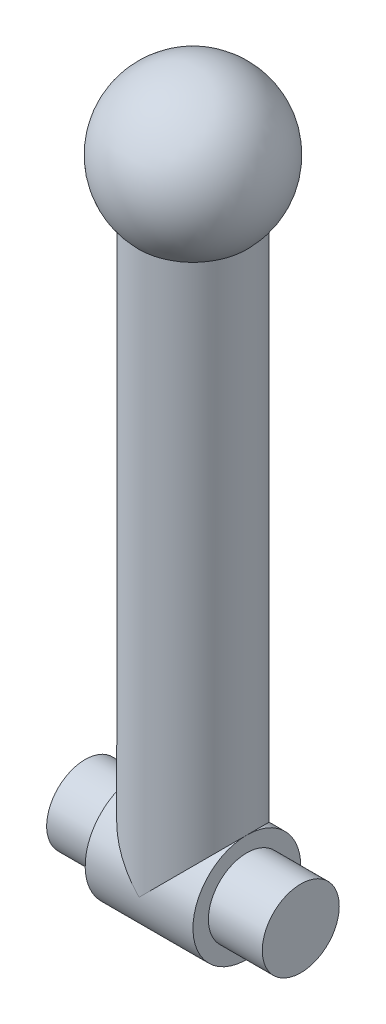
from build123d import *
from build123d.topology import SkipClean

# Parameters (mm, degrees)
SKETCH1_R                = 35
BOSS_EXTRUDE1_DEPTH      = 400
BOSS_EXTRUDE2_DEPTH      = 35
BOSS_EXTRUDE2_DEPTH_BACK = 35
SKETCH3_R                = 35
SKETCH4_R                = 25
BOSS_EXTRUDE3_DEPTH      = 35


with BuildPart() as part:
    # Sketch1 → Boss-Extrude1 (new body)
    with BuildSketch(Plane(origin=(0, 0, 0), x_dir=(1, 0, 0), z_dir=(0, 1, 0))):
        Circle(SKETCH1_R)
    extrude(amount=BOSS_EXTRUDE1_DEPTH)

    # Sketch2 → Revolve1 (revolve)
    with BuildSketch(Plane(origin=(0, 400, 0), x_dir=(1, 0, 0), z_dir=(0, 1, 0))):
        with BuildLine():
            ThreePointArc((0, -50), (50, 0), (0, 50))
            Line((0, 50), (0, -50))
        make_face()
    revolve(axis=Axis((0, 400, -50), (0, 0, 1)))

    # Sketch3 → Boss-Extrude2 (add, two sides: drawn at the far end of the back side and taken through both)
    with SkipClean():  # the faces are left unmerged after this step: merging them gives an invalid solid
        with BuildSketch(Plane(origin=(0, 0, 0), x_dir=(0, 0, -1), z_dir=(1, 0, 0)).offset(-BOSS_EXTRUDE2_DEPTH_BACK)):
            Circle(SKETCH3_R)
        extrude(amount=BOSS_EXTRUDE2_DEPTH + BOSS_EXTRUDE2_DEPTH_BACK)

    # Sketch4 → Boss-Extrude3 (add)
    with SkipClean():  # the faces are left unmerged after this step: merging them gives an invalid solid
        with BuildSketch(Plane(origin=(35, 0, 0), x_dir=(0, 0, -1), z_dir=(1, 0, 0))):
            Circle(SKETCH4_R)
        boss_extrude3 = extrude(amount=BOSS_EXTRUDE3_DEPTH)

    # Mirror1: Boss-Extrude3 across plane
    with SkipClean():  # the faces are left unmerged after this step: merging them gives an invalid solid
        add(boss_extrude3.mirror(Plane(origin=(0, 0, 0), x_dir=(0, 0, 1), z_dir=(1, 0, 0))))


solid = part.part
